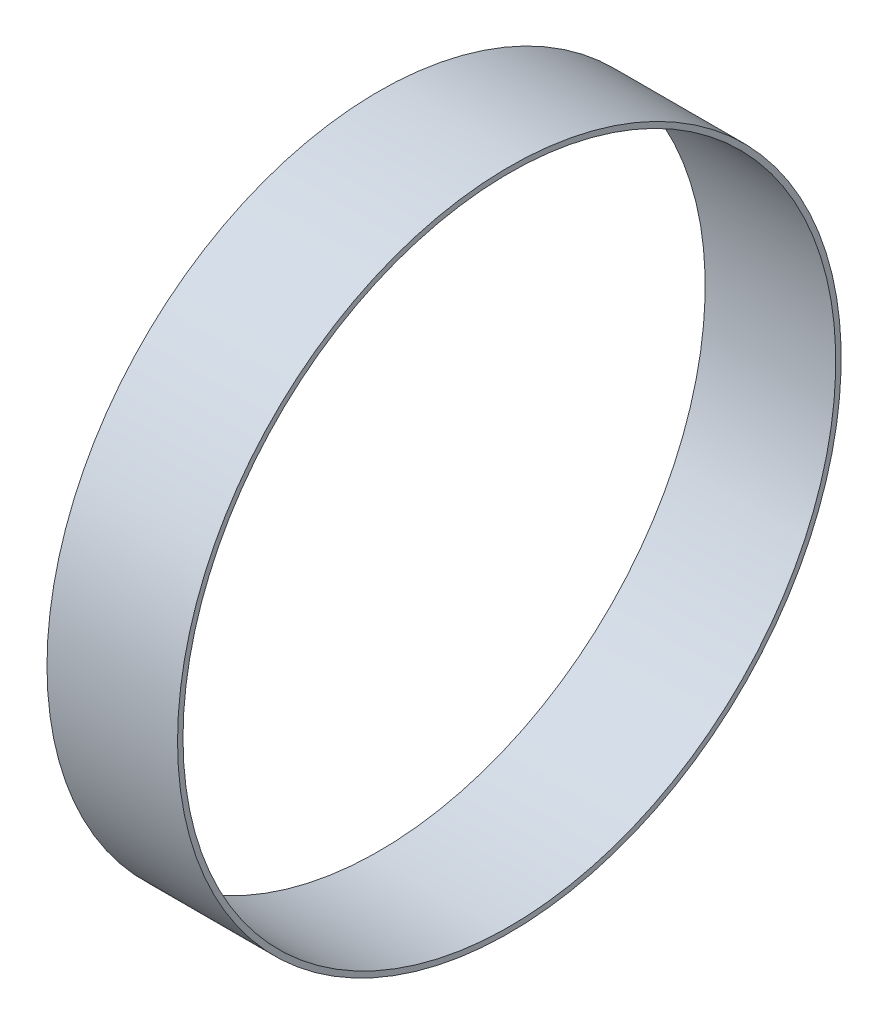
from build123d import *

# Parameters (mm, degrees)
SKETCH1_R           = 193.675
SKETCH1_R_2         = 190.5
BOSS_EXTRUDE1_DEPTH = 76.2


with BuildPart() as part:
    # Sketch1 → Boss-Extrude1 (new body)
    with BuildSketch(Plane(origin=(0, 0, 0), x_dir=(0, 0, -1), z_dir=(1, 0, 0))):
        Circle(SKETCH1_R)
        Circle(SKETCH1_R_2, mode=Mode.SUBTRACT)
    extrude(amount=BOSS_EXTRUDE1_DEPTH)


solid = part.part
